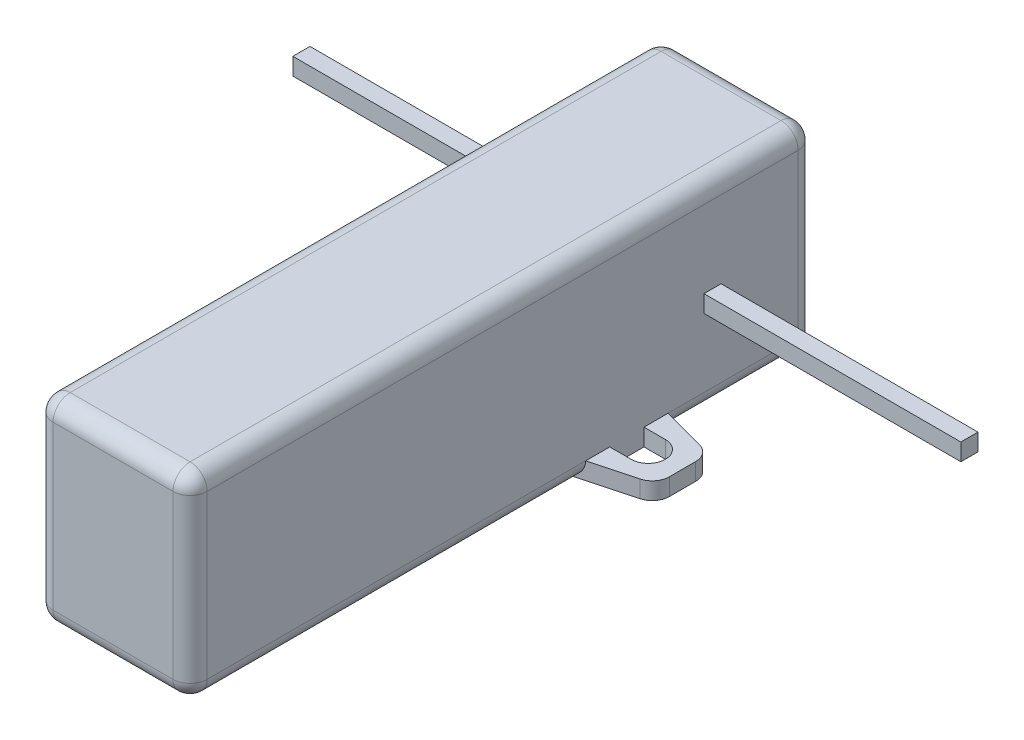
from build123d import *

# Parameters (mm, degrees)
HOLES_EXTRUDE_DEPTH      = 2
HOLES_EXTRUDE_2_DEPTH    = 2
MOTOR_START              = -9
MOTOR_EXTRUDE_OUTLINE_W  = 23
MOTOR_EXTRUDE_OUTLINE_H  = 73
MOTOR_EXTRUDE_DEPTH      = 18
SKETCH3_W                = 2
SKETCH3_H                = 2
LEFT_SHAFT_EXTRUDE_DEPTH = 39
MOTOR_EDGE_FILLET_R      = 2
HOLES_FILLET_R           = 2


# Read off the part's stored shape, not the designer's step: Motor Extrude
with BuildPart() as part:
    # Bottom Profile Sketch → Holes Extrude (new body)
    with BuildSketch(Plane(origin=(0, 0, 0), x_dir=(1, 0, 0), z_dir=(0, 1, 0))):
        with BuildLine():
            Line((-9, -8), (-9, -5.189022297))
            Line((-9, -5.189022297), (-15.5, -6.930692048))
            Line((-15.5, -6.930692048), (-15.5, -13.069307952))
            Line((-15.5, -13.069307952), (-9, -14.810977703))
            Line((-9, -14.810977703), (-9, -12))
            Line((-9, -12), (-11.5, -12))
            ThreePointArc((-11.5, -12), (-13.5, -10), (-11.5, -8))
            Line((-11.5, -8), (-9, -8))
        make_face()
    extrude(amount=HOLES_EXTRUDE_DEPTH)



with BuildPart() as body_2:
    # Bottom Profile Sketch → Holes Extrude 2 (new body)
    with BuildSketch(Plane(origin=(0, 0, 0), x_dir=(1, 0, 0), z_dir=(0, 1, 0))):
        with BuildLine():
            Line((15.5, -6.930692048), (9, -5.189022297))
            Line((9, -5.189022297), (9, -8))
            Line((9, -8), (11.5, -8))
            ThreePointArc((11.5, -8), (13.5, -10), (11.5, -12))
            Line((11.5, -12), (9, -12))
            Line((9, -12), (9, -14.810977703))
            Line((9, -14.810977703), (15.5, -13.069307952))
            Line((15.5, -13.069307952), (15.5, -6.930692048))
        make_face()
    extrude(amount=HOLES_EXTRUDE_2_DEPTH)


with BuildPart() as part_1:
    add(part.part)

    add(body_2.part)  # Motor Extrude merges body 2
    # Motor Extrude outline → Motor Extrude (add)
    with BuildSketch(Plane.YZ.offset(MOTOR_START)):
        with Locations((11.5, 24.5)):
            Rectangle(MOTOR_EXTRUDE_OUTLINE_W, MOTOR_EXTRUDE_OUTLINE_H)
    extrude(amount=MOTOR_EXTRUDE_DEPTH)

    # Motor Edge Fillet
    motor_edge_fillet_edges = [part_1.edges().sort_by_distance(p)[0] for p in [
        (0, 0, -12),
        (0, 23, -12),
        (9, 11.5, -12),
        (9, 0, -3.405488851),
        (9, 0, 37.905488851),
        (0, 0, 61),
        (0, 23, 61),
        (9, 11.5, 61),
        (-9, 11.5, 61),
        (-9, 0, -3.405488851),
        (-9, 0, 37.905488851),
        (-9, 11.5, -12),
        (-9, 23, 24.5),
        (9, 23, 24.5),
    ]]
    fillet(motor_edge_fillet_edges, radius=MOTOR_EDGE_FILLET_R)

    # Holes Fillet
    holes_fillet_edges = [part_1.edges().sort_by_distance(p)[0] for p in [
        (-15.5, 1, 13.069307952),
        (-15.5, 1, 6.930692048),
        (15.5, 1, 13.069307952),
        (15.5, 1, 6.930692048),
    ]]
    fillet(holes_fillet_edges, radius=HOLES_FILLET_R)


with BuildPart() as body_2_2:
    # Sketch3 → Left Shaft Extrude (new, symmetric)
    with BuildSketch(Plane(origin=(0, 0, 0), x_dir=(0, 0, -1), z_dir=(1, 0, 0))):
        with Locations((0, 11)):
            Rectangle(SKETCH3_W, SKETCH3_H)
    extrude(amount=LEFT_SHAFT_EXTRUDE_DEPTH, both=True)


solid = Compound([part_1.part, body_2_2.part])
